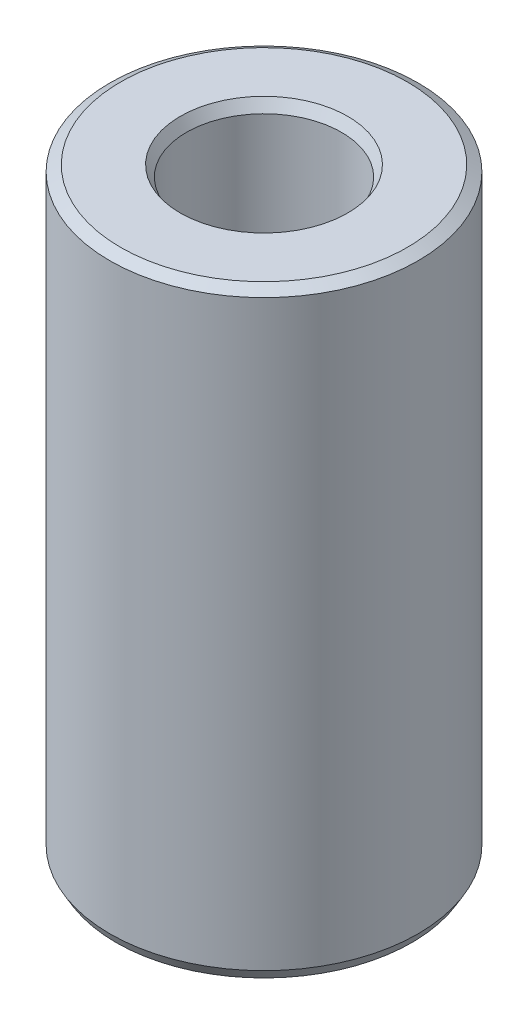
from build123d import *
from OCP.BRepFilletAPI import BRepFilletAPI_MakeChamfer

# Parameters (mm, degrees)
SKETCH1_R           = 52.5
BOSS_EXTRUDE1_DEPTH = 204.351669064
SKETCH2_R           = 26.426949823
CUT_EXTRUDE1_DEPTH  = 218.421490771
CHAMFER1_SIZE       = 2.112772769
CHAMFER1_SIZE2      = 3.65942978


with BuildPart() as part:
    # Sketch1 → Boss-Extrude1 (new body)
    with BuildSketch(Plane(origin=(0, 0, 0), x_dir=(1, 0, 0), z_dir=(0, 1, 0))):
        Circle(SKETCH1_R)
    extrude(amount=BOSS_EXTRUDE1_DEPTH)

    # Sketch2 → Cut-Extrude1 (cut, through all)
    with BuildSketch(Plane(origin=(0, 0, 0), x_dir=(1, 0, 0), z_dir=(0, 1, 0))):
        Circle(SKETCH2_R)
    extrude(amount=CUT_EXTRUDE1_DEPTH, mode=Mode.SUBTRACT)

    # Chamfer1: one chamfer whose edges measure the first distance from different faces: ONE call of the kernel's chamfer builder (chamfer() names one face for all edges)
    chamfer1_edges_1 = [part.edges().sort_by_distance(p)[0] for p in [
        (-26.426949823, 204.351669064, 0),
    ]]
    chamfer1_side_1 = [part.faces().sort_by_distance(p)[0] for p in [
        (-51.01507576, 204.351669064, 0),
    ]]
    chamfer1_edges_2 = [part.edges().sort_by_distance(p)[0] for p in [
        (-26.426949823, 0, 0),
    ]]
    chamfer1_side_2 = [part.faces().sort_by_distance(p)[0] for p in [
        (-26.426949823, 102.175834532, 0),
    ]]
    chamfer1_edges_3 = [part.edges().sort_by_distance(p)[0] for p in [
        (-52.5, 0, 0),
    ]]
    chamfer1_side_3 = [part.faces().sort_by_distance(p)[0] for p in [
        (-51.01507576, 0, 0),
    ]]
    chamfer1_edges_4 = [part.edges().sort_by_distance(p)[0] for p in [
        (-52.5, 204.351669064, 0),
    ]]
    chamfer1_side_4 = [part.faces().sort_by_distance(p)[0] for p in [
        (-52.5, 102.175834532, 0),
    ]]
    chamfer1 = BRepFilletAPI_MakeChamfer(part.part.solid().wrapped)
    for e in chamfer1_edges_1:
        chamfer1.Add(CHAMFER1_SIZE, CHAMFER1_SIZE2, e.wrapped, chamfer1_side_1[0].wrapped)  # the first distance lies on this face
    for e in chamfer1_edges_2:
        chamfer1.Add(CHAMFER1_SIZE, CHAMFER1_SIZE2, e.wrapped, chamfer1_side_2[0].wrapped)  # the first distance lies on this face
    for e in chamfer1_edges_3:
        chamfer1.Add(CHAMFER1_SIZE, CHAMFER1_SIZE2, e.wrapped, chamfer1_side_3[0].wrapped)  # the first distance lies on this face
    for e in chamfer1_edges_4:
        chamfer1.Add(CHAMFER1_SIZE, CHAMFER1_SIZE2, e.wrapped, chamfer1_side_4[0].wrapped)  # the first distance lies on this face
    add(Compound.cast(chamfer1.Shape()), mode=Mode.REPLACE)


solid = part.part
